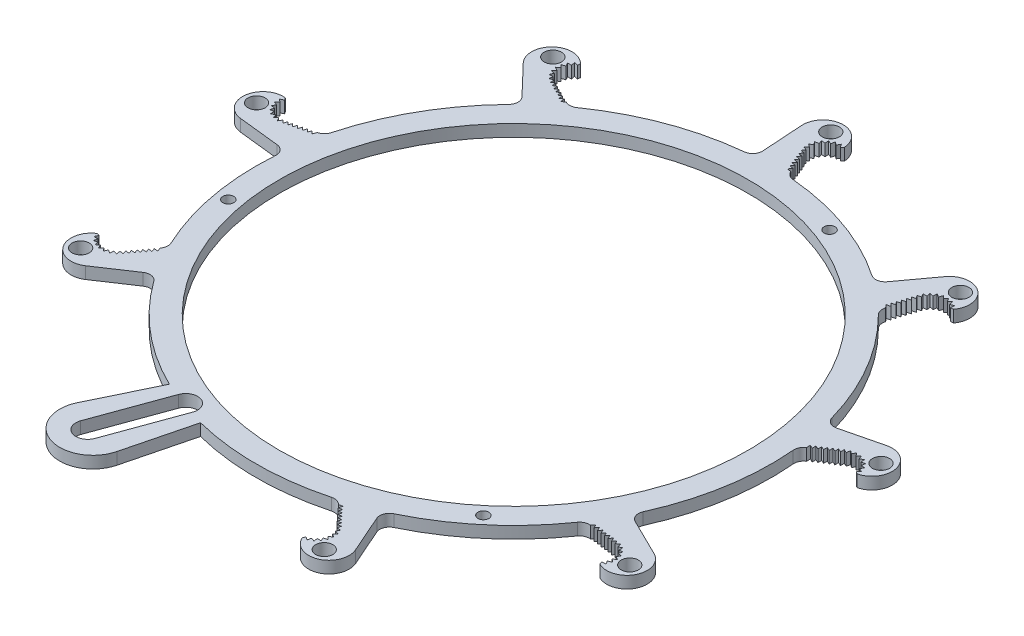
from build123d import *

# Parameters (mm, degrees)
SKETCH1_R           = 68.58
SKETCH1_R_2         = 55.88
BOSS_EXTRUDE1_DEPTH = 3.175
BOSS_EXTRUDE2_START = -3.175
BOSS_EXTRUDE2_DEPTH = 3.175
CIRPATTERN1_COUNT   = 9
SKETCH4_R           = 1.27
CUT_EXTRUDE1_DEPTH  = 124.088082607
CIRPATTERN14_COUNT  = 4
SKETCH5_R           = 62.357
CUT_EXTRUDE2_DEPTH  = 124.088082607
SKETCH7_R           = 1.4605
CUT_EXTRUDE4_DEPTH  = 124.088082607
CIRPATTERN16_COUNT  = 3
CUT_EXTRUDE5_DEPTH  = 124.088082607
CRVPATTERN1_DEPTH   = 3.175
CIRPATTERN17_COUNT  = 9
BOSS_EXTRUDE5_START = -3.175
BOSS_EXTRUDE5_DEPTH = 3.175
SKETCH3_R           = 2.286
CUT_EXTRUDE7_DEPTH  = 124.088082607
CIRPATTERN18_COUNT  = 9
BOSS_EXTRUDE6_START = -3.175
BOSS_EXTRUDE6_DEPTH = 3.175
CUT_EXTRUDE8_DEPTH  = 126.425661484


# Read off the part's stored shape, not the designer's step: CrvPattern1
with BuildPart() as part:
    # Sketch1 → Boss-Extrude1 (new body)
    with BuildSketch(Plane(origin=(0, 0, 0), x_dir=(1, 0, 0), z_dir=(0, 1, 0))):
        with Locations(Location((0, 0, 0), (0, 0, 270))):
            Circle(SKETCH1_R)
        with Locations(Location((0, 0, 0), (0, 0, 270))):
            Circle(SKETCH1_R_2, mode=Mode.SUBTRACT)
    extrude(amount=BOSS_EXTRUDE1_DEPTH)

    # Sketch2 → Boss-Extrude2 (add)
    with BuildSketch(Plane(origin=(0, 3.175, 0), x_dir=(1, 0, 0), z_dir=(0, 1, 0)).offset(BOSS_EXTRUDE2_START)):
        with BuildLine():
            Line((-4.648503105, 70.922452149), (-5.367925957, 81.898723786))
            ThreePointArc((-5.367925957, 81.898723786), (0, 87.63), (5.367925957, 81.898723786))
            ThreePointArc((5.367925957, 81.898723786), (1.585103244, 80.66312392), (0.966324082, 76.732021396))
            Line((0.966324082, 76.732021396), (3.81, 69.87951531))
            ThreePointArc((3.81, 69.87951531), (4.65537594, 68.803759817), (5.936157335, 68.322605601))
            ThreePointArc((5.936157335, 68.322605601), (-0.497376724, 68.578196363), (-6.926526743, 68.22931648))
            ThreePointArc((-6.926526743, 68.22931648), (-5.243785443, 69.115963701), (-4.648503105, 70.922452149))
        make_face()
    boss_extrude2 = extrude(amount=BOSS_EXTRUDE2_DEPTH)

    # CirPattern1: Boss-Extrude2 ×9 about axis
    cirpattern1_axis = Axis((0, 0, 0), (0, 1, 0))
    for i in range(1, CIRPATTERN1_COUNT):
        add(boss_extrude2.rotate(cirpattern1_axis, i * 360 / CIRPATTERN1_COUNT))

    # Sketch4 → Cut-Extrude1 (cut, through all)
    with BuildSketch(Plane(origin=(0, 3.175, 0), x_dir=(1, 0, 0), z_dir=(0, 1, 0))):
        with Locations(Location((41.758190963, 41.758190963, 0), (0, 0, 270))):
            Circle(SKETCH4_R)
    cut_extrude1 = extrude(amount=-CUT_EXTRUDE1_DEPTH, mode=Mode.SUBTRACT)

    # CirPattern14: Cut-Extrude1 ×4 about axis
    cirpattern14_axis = Axis((0, 0, 0), (0, 1, 0))
    for i in range(1, CIRPATTERN14_COUNT):
        add(cut_extrude1.rotate(cirpattern14_axis, i * 360 / CIRPATTERN14_COUNT), mode=Mode.SUBTRACT)

    # Sketch5 → Cut-Extrude2 (cut, through all)
    with BuildSketch(Plane(origin=(0, 3.175, 0), x_dir=(1, 0, 0), z_dir=(0, 1, 0))):
        with Locations(Location((0, 0, 0), (0, 0, 270))):
            Circle(SKETCH5_R)
    extrude(amount=-CUT_EXTRUDE2_DEPTH, mode=Mode.SUBTRACT)

    # Sketch7 → Cut-Extrude4 (cut, through all)
    with BuildSketch(Plane(origin=(0, 3.175, 0), x_dir=(1, 0, 0), z_dir=(0, 1, 0))):
        with Locations(Location((22.413264032, 61.579936825, 0), (0, 0, 270))):
            Circle(SKETCH7_R)
    cut_extrude4 = extrude(amount=-CUT_EXTRUDE4_DEPTH, mode=Mode.SUBTRACT)

    # CirPattern16: Cut-Extrude4 ×3 about axis
    cirpattern16_axis = Axis((0, 0, 0), (0, 1, 0))
    for i in range(1, CIRPATTERN16_COUNT):
        add(cut_extrude4.rotate(cirpattern16_axis, i * 360 / CIRPATTERN16_COUNT), mode=Mode.SUBTRACT)

    # Sketch9 → Cut-Extrude5 (cut, through all)
    with BuildSketch(Plane(origin=(0, 3.175, 0), x_dir=(1, 0, 0), z_dir=(0, 1, 0))):
        Polygon((3.47094583, 71.027887706), (3.957724412, 69.854880199), (2.775929115, 70.051961086), align=None)
    cut_extrude5 = extrude(amount=-CUT_EXTRUDE5_DEPTH, mode=Mode.SUBTRACT)

    # CrvPattern1 outline → CrvPattern1 (cut)
    with BuildSketch(Plane(origin=(0, 0, 0), x_dir=(1, 0, 0), z_dir=(0, 1, 0))):
        with BuildLine():
            Line((2.954390649, 71.893612642), (2.35875647, 71.057236713))
            Line((2.35875647, 71.057236713), (3.371563294, 70.888337016))
            Line((3.371563294, 70.888337016), (3.38406874, 70.905896878))
            Line((3.38406874, 70.905896878), (0.966324082, 76.732021396))
            ThreePointArc((0.966324082, 76.732021396), (1.585103244, 80.66312392), (5.367925957, 81.898723786))
            ThreePointArc((5.367925957, 81.898723786), (5.37940733, 82.230759048), (5.370370135, 82.562869823))
            Line((5.370370135, 82.562869823), (4.835817307, 82.035720051))
            Line((4.835817307, 82.035720051), (4.241589962, 82.88503055))
            Line((4.241589962, 82.88503055), (3.738556552, 81.978723842))
            Line((3.738556552, 81.978723842), (2.929076067, 82.62616172))
            Line((2.929076067, 82.62616172), (2.701825603, 81.614830079))
            Line((2.701825603, 81.614830079), (1.74270305, 82.007918354))
            Line((1.74270305, 82.007918354), (1.809654933, 80.973533557))
            Line((1.809654933, 80.973533557), (0.778630371, 81.080411122))
            Line((0.778630371, 81.080411122), (1.13435793, 80.106813481))
            Line((1.13435793, 80.106813481), (0.114999311, 79.918817556))
            Line((0.114999311, 79.918817556), (0.73066965, 79.084920383))
            Line((0.73066965, 79.084920383), (-0.194400635, 78.617288659))
            Line((-0.194400635, 78.617288659), (0.631310365, 77.990682079))
            Line((0.631310365, 77.990682079), (-0.124491578, 77.281317657))
            Line((-0.124491578, 77.281317657), (0.859335479, 76.907083655))
            Line((0.859335479, 76.907083655), (0.272893244, 76.083614844))
            Line((0.272893244, 76.083614844), (1.285700068, 75.914715147))
            Line((1.285700068, 75.914715147), (0.690065889, 75.078339218))
            Line((0.690065889, 75.078339218), (1.702872713, 74.909439521))
            Line((1.702872713, 74.909439521), (1.107238535, 74.073063591))
            Line((1.107238535, 74.073063591), (2.120045358, 73.904163894))
            Line((2.120045358, 73.904163894), (1.52441118, 73.067787965))
            Line((1.52441118, 73.067787965), (2.537218003, 72.898888268))
            Line((2.537218003, 72.898888268), (1.941583825, 72.062512339))
            Line((1.941583825, 72.062512339), (2.954390649, 71.893612642))
        make_face()
    crvpattern1 = extrude(amount=CRVPATTERN1_DEPTH, mode=Mode.SUBTRACT)

    # CirPattern17: Cut-Extrude5, CrvPattern1 ×9 about axis, 1 skipped
    cirpattern17_axis = Axis((0, 0, 0), (0, 1, 0))
    add([cut_extrude5.rotate(cirpattern17_axis, i * 360 / CIRPATTERN17_COUNT) for i in range(1, CIRPATTERN17_COUNT) if i not in (4,)], mode=Mode.SUBTRACT)
    add([crvpattern1.rotate(cirpattern17_axis, i * 360 / CIRPATTERN17_COUNT) for i in range(1, CIRPATTERN17_COUNT) if i not in (4,)], mode=Mode.SUBTRACT)

    # Sketch12 → Boss-Extrude5 (add)
    with BuildSketch(Plane(origin=(0, 3.175, 0), x_dir=(1, 0, 0), z_dir=(0, 1, 0)).offset(BOSS_EXTRUDE5_START)):
        with BuildLine():
            ThreePointArc((-27.480430727, -64.362168135), (-27.578451147, -63.76717173), (-27.81396741, -63.212049387))
            Line((-27.81396741, -63.212049387), (-33.055213658, -75.123687588))
            ThreePointArc((-33.055213658, -75.123687588), (-29.077923026, -75.256405078), (-27.151944564, -71.774011983))
            Line((-27.151944564, -71.774011983), (-27.480430727, -64.362168135))
        make_face()
    extrude(amount=BOSS_EXTRUDE5_DEPTH)

    # Sketch3 → Cut-Extrude7 (cut, through all)
    with BuildSketch(Plane(origin=(0, 3.175, 0), x_dir=(1, 0, 0), z_dir=(0, 1, 0))):
        with Locations(Location((0, 84.328, 0), (0, 0, 270))):
            Circle(SKETCH3_R)
    cut_extrude7 = extrude(amount=-CUT_EXTRUDE7_DEPTH, mode=Mode.SUBTRACT)

    # CirPattern18: Cut-Extrude7 ×9 about axis, 1 skipped
    cirpattern18_axis = Axis((0, 0, 0), (0, -1, 0))
    add([cut_extrude7.rotate(cirpattern18_axis, i * 360 / CIRPATTERN18_COUNT) for i in range(1, CIRPATTERN18_COUNT) if i not in (5,)], mode=Mode.SUBTRACT)

    # Sketch15 → Boss-Extrude6 (add)
    with BuildSketch(Plane(origin=(0, 3.175, 0), x_dir=(1, 0, 0), z_dir=(0, 1, 0)).offset(BOSS_EXTRUDE6_START)):
        with BuildLine():
            Line((-33.055213658, -75.123687588), (-27.81396741, -63.212049387))
            ThreePointArc((-27.81396741, -63.212049387), (-28.299348207, -62.604322733), (-28.945870603, -62.171962934))
            ThreePointArc((-28.945870603, -62.171962934), (-29.396011744, -61.960397784), (-29.844606669, -61.745573548))
            Line((-29.844606669, -61.745573548), (-37.810127766, -78.225457977))
            ThreePointArc((-37.810127766, -78.225457977), (-32.885535913, -90.352267346), (-21.318116881, -84.228059042))
            Line((-21.318116881, -84.228059042), (-16.826994534, -66.483596887))
            ThreePointArc((-16.826994534, -66.483596887), (-18.711505325, -66.741241317), (-19.888743183, -68.235186631))
            Line((-19.888743183, -68.235186631), (-22.966812837, -78.795565198))
            ThreePointArc((-22.966812837, -78.795565198), (-29.97122516, -82.345264359), (-33.055213658, -75.123687588))
        make_face()
    extrude(amount=BOSS_EXTRUDE6_DEPTH)

    # Sketch16 → Cut-Extrude8 (cut, through all)
    with BuildSketch(Plane(origin=(0, 3.175, 0), x_dir=(1, 0, 0), z_dir=(0, 1, 0))):
        with BuildLine():
            Line((-20.298471125, -65.052670037), (-27.248320438, -84.147224092))
            ThreePointArc((-27.248320438, -84.147224092), (-31.317758464, -86.044834208), (-33.21536858, -81.975396181))
            Line((-33.21536858, -81.975396181), (-26.265519267, -62.880842127))
            ThreePointArc((-26.265519267, -62.880842127), (-22.196081241, -60.983232011), (-20.298471125, -65.052670037))
        make_face()
    extrude(amount=-CUT_EXTRUDE8_DEPTH, mode=Mode.SUBTRACT)


solid = part.part
